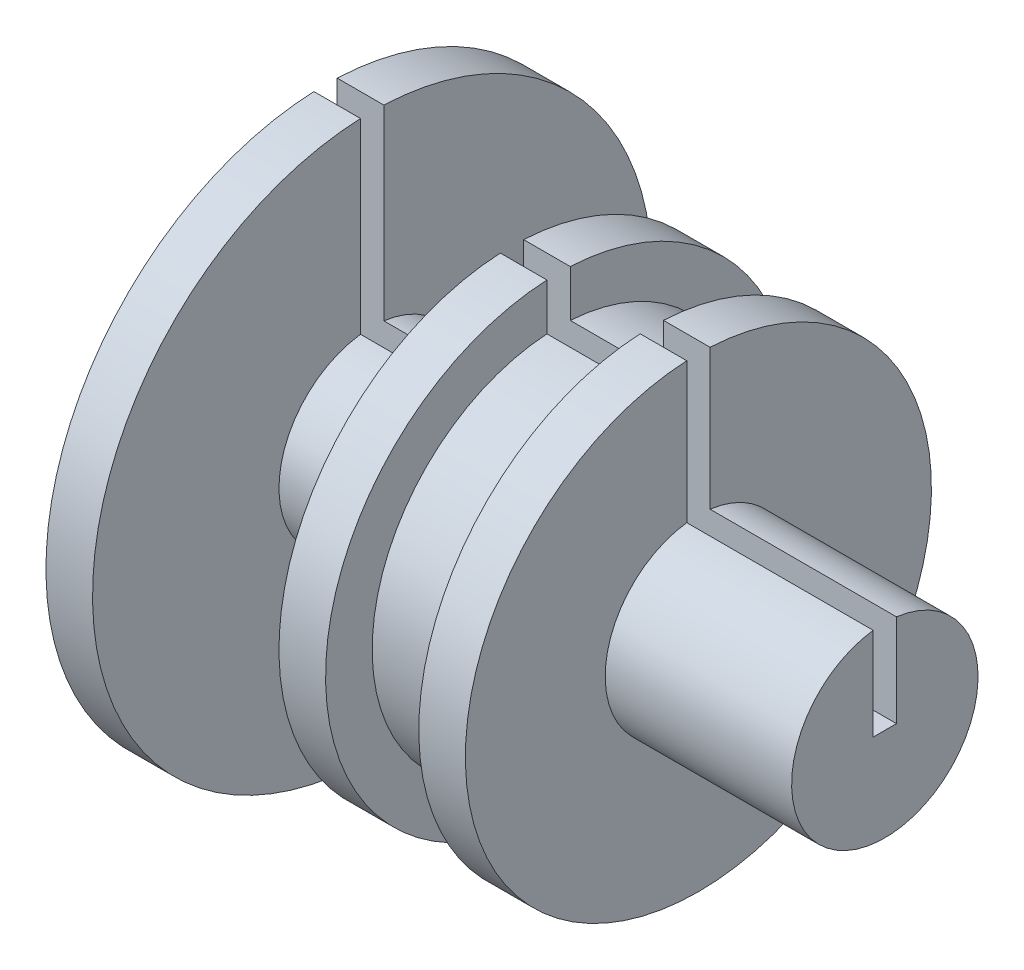
from build123d import *

# Parameters (mm, degrees)
SKETCH2_W          = 2.5
SKETCH2_H          = 34.957041577
CUT_EXTRUDE1_DEPTH = 74.484692283


with BuildPart() as part:
    # Sketch1 → Revolve1 (revolve)
    with BuildSketch(Plane.XY):
        Polygon((20, 10), (5, 10), (5, 30), (0, 30), (0, 0), (60, 0), (60, 10), (40, 10), (40, 25), (35, 25), (35, 20), (25, 20), (25, 25), (20, 25), align=None)
    revolve(axis=Axis((0, 0, 0), (1, 0, 0)))

    # Sketch2 → Cut-Extrude1 (cut, through all)
    with BuildSketch(Plane(origin=(60, 0, 0), x_dir=(0, 0, -1), z_dir=(1, 0, 0))):
        with Locations((0, 17.478520789)):
            Rectangle(SKETCH2_W, SKETCH2_H)
    extrude(amount=-CUT_EXTRUDE1_DEPTH, mode=Mode.SUBTRACT)


solid = part.part
